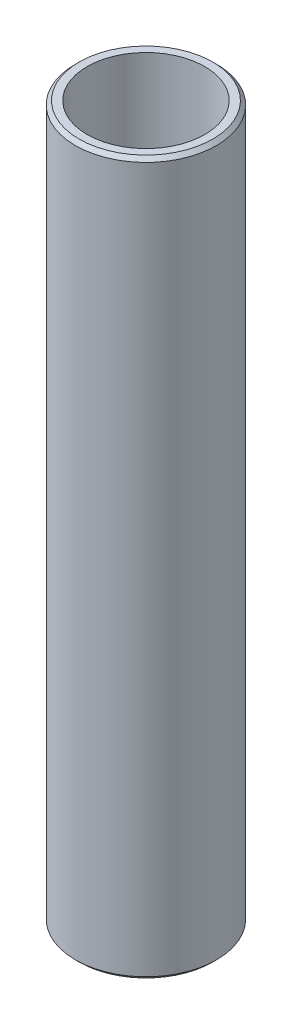
from build123d import *

# Parameters (mm, degrees)
SKETCH1_R           = 47.5
BOSS_EXTRUDE1_DEPTH = 479.857106733
SKETCH2_R           = 39.63687515
CUT_EXTRUDE1_DEPTH  = 485.536214211
CHAMFER1_SIZE       = 2.513379282


with BuildPart() as part:
    # Sketch1 → Boss-Extrude1 (new body)
    with BuildSketch(Plane(origin=(0, 0, 0), x_dir=(1, 0, 0), z_dir=(0, 1, 0))):
        Circle(SKETCH1_R)
    extrude(amount=BOSS_EXTRUDE1_DEPTH)

    # Sketch2 → Cut-Extrude1 (cut, through all)
    with BuildSketch(Plane(origin=(0, 0, 0), x_dir=(1, 0, 0), z_dir=(0, 1, 0))):
        Circle(SKETCH2_R)
    extrude(amount=CUT_EXTRUDE1_DEPTH, mode=Mode.SUBTRACT)

    # Chamfer1
    chamfer1_edges = [part.edges().sort_by_distance(p)[0] for p in [
        (-47.5, 479.857106733, 0),
        (-47.5, 0, 0),
    ]]
    chamfer(chamfer1_edges, length=CHAMFER1_SIZE)


solid = part.part
